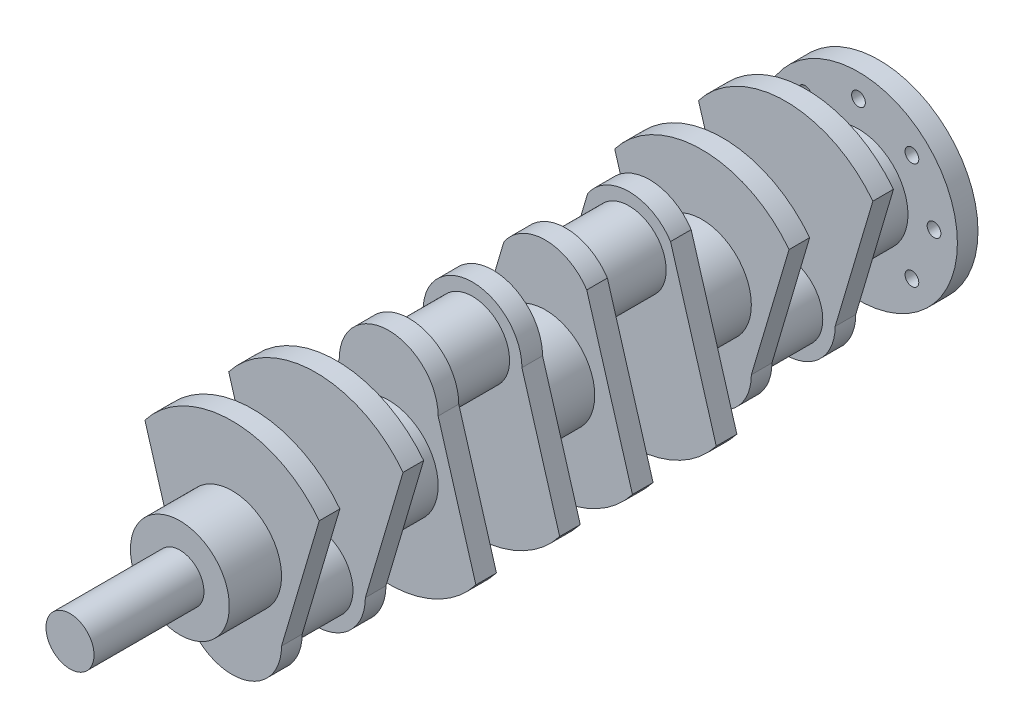
from build123d import *

# Parameters (mm, degrees)
BOSS_EXTRUDE1_DEPTH   = 15
SKETCH2_R             = 27
BOSS_EXTRUDE2_DEPTH   = 46
SKETCH3_R             = 36
BOSS_EXTRUDE3_DEPTH   = 38
SPLIT1_START          = 175
SPLIT1_OUTLINE_R      = 36
SPLIT1_DEPTH          = 53
SPLIT1_START_2        = 114
SPLIT1_2_DEPTH        = 15
SPLIT1_3_OUTLINE_R    = 36
SPLIT1_3_DEPTH        = 15
SPLIT1_START_3        = 129
SPLIT1_4_OUTLINE_R    = 27
SPLIT1_4_DEPTH        = 46
SPLIT1_5_DEPTH        = 114
SPLIT1_6_DEPTH        = 76
SPLIT1_7_DEPTH        = 15
SPLIT1_START_4        = 61
SPLIT1_8_DEPTH        = 15
SPLIT1_9_DEPTH        = 15
SPLIT1_10_DEPTH       = 15
BODY_MOVE_COPY2_ANGLE = 180
SKETCH4_R             = 17.5
BOSS_EXTRUDE4_DEPTH   = 80
SKETCH5_R             = 72
SKETCH5_R_2           = 5
BOSS_EXTRUDE5_DEPTH   = 15


# Read off the part's stored shape, not the designer's step: Split1
with BuildPart() as part:
    # Sketch1 → Boss-Extrude1 (new body)
    with BuildSketch(Plane.XY):
        with BuildLine():
            Line((-63.461769721, 48.709380861), (-36, -44))
            ThreePointArc((-36, -44), (0, -80), (36, -44))
            Line((36, -44), (63.461769721, 48.709380861))
            ThreePointArc((63.461769721, 48.709380861), (0, 80), (-63.461769721, 48.709380861))
        make_face()
    boss_extrude1 = extrude(amount=BOSS_EXTRUDE1_DEPTH)

    # Sketch2 → Boss-Extrude2 (add)
    with BuildSketch(Plane.XY.offset(15)):
        with Locations((0, -44)):
            Circle(SKETCH2_R)
    extrude(amount=BOSS_EXTRUDE2_DEPTH)

    # Sketch3 → Boss-Extrude3 (add)
    with BuildSketch(Plane(origin=(0, 0, 0), x_dir=(-1, 0, 0), z_dir=(0, 0, -1))):
        Circle(SKETCH3_R)
    boss_extrude3 = extrude(amount=BOSS_EXTRUDE3_DEPTH)

    # Mirror1: Boss-Extrude1, Boss-Extrude3 across plane
    add(boss_extrude1.mirror(Plane.XY.offset(38)))
    add(boss_extrude3.mirror(Plane.XY.offset(38)))

    # Mirror7: part across plane


with BuildPart() as part_1:
    add(part.part)
    add(part.part.mirror(Plane.XY.offset(95)))

    # Split1 5 outline → Split1 5 (cut)
    with BuildSketch(Plane.XY.offset(SPLIT1_START_2)):
        with BuildLine():
            Line((36, -44), (63.461769721, 48.709380861))
            ThreePointArc((63.461769721, 48.709380861), (0, 80), (-63.461769721, 48.709380861))
            Line((-63.461769721, 48.709380861), (-36, -44))
            ThreePointArc((-36, -44), (0, -80), (36, -44))
        make_face()
    extrude(amount=SPLIT1_5_DEPTH, mode=Mode.SUBTRACT)

    # Split1 6 outline → Split1 6 (cut)
    with BuildSketch(Plane.XY):
        with BuildLine():
            Line((36, -44), (30.192140446, -63.607005261))
            ThreePointArc((30.192140446, -63.607005261), (34.517510455, -54.22455241), (36, -44))
        make_face()
        with BuildLine():
            ThreePointArc((-36, -44), (-34.517510455, -54.22455241), (-30.192140446, -63.607005261))
            Line((-30.192140446, -63.607005261), (-36, -44))
        make_face()
    extrude(amount=SPLIT1_6_DEPTH, mode=Mode.SUBTRACT)


with BuildPart() as body_2:
    # Split1 outline → Split1 (new body)
    with BuildSketch(Plane.XY.offset(SPLIT1_START)):
        Circle(SPLIT1_OUTLINE_R)
    extrude(amount=SPLIT1_DEPTH)

    # Split1 2 outline → Split1 2 (add)
    with BuildSketch(Plane.XY.offset(SPLIT1_START_2)):
        with BuildLine():
            ThreePointArc((-36, -44), (0, -80), (36, -44))
            Line((36, -44), (63.461769721, 48.709380861))
            ThreePointArc((63.461769721, 48.709380861), (0, 80), (-63.461769721, 48.709380861))
            Line((-63.461769721, 48.709380861), (-36, -44))
        make_face()
    extrude(amount=SPLIT1_2_DEPTH)

    # Split1 3 outline → Split1 3 (add)
    with BuildSketch(Plane.XY.offset(SPLIT1_START)):
        with BuildLine():
            ThreePointArc((-36, -44), (0, -80), (36, -44))
            Line((36, -44), (63.461769721, 48.709380861))
            ThreePointArc((63.461769721, 48.709380861), (0, 80), (-63.461769721, 48.709380861))
            Line((-63.461769721, 48.709380861), (-36, -44))
        make_face()
        Circle(SPLIT1_3_OUTLINE_R, mode=Mode.SUBTRACT)
    extrude(amount=SPLIT1_3_DEPTH)

    # Split1 4 outline → Split1 4 (add)
    with BuildSketch(Plane.XY.offset(SPLIT1_START_3)):
        with Locations((0, -44)):
            Circle(SPLIT1_4_OUTLINE_R)
    extrude(amount=SPLIT1_4_DEPTH)


with BuildPart() as body_3:
    # Split1 7 outline → Split1 7 (new body)
    with BuildSketch(Plane.XY):
        with BuildLine():
            Line((36, -44), (30.192140446, -63.607005261))
            ThreePointArc((30.192140446, -63.607005261), (34.517510455, -54.224552409), (36, -44))
        make_face()
    extrude(amount=SPLIT1_7_DEPTH)


with BuildPart() as body_4:
    # Split1 8 outline → Split1 8 (new body)
    with BuildSketch(Plane.XY.offset(SPLIT1_START_4)):
        with BuildLine():
            Line((-30.192140446, -63.607005261), (-36, -44))
            ThreePointArc((-36, -44), (-34.517510455, -54.224552409), (-30.192140446, -63.607005261))
        make_face()
    extrude(amount=SPLIT1_8_DEPTH)


with BuildPart() as body_5:
    # Split1 9 outline → Split1 9 (new body)
    with BuildSketch(Plane.XY.offset(SPLIT1_START_4)):
        with BuildLine():
            Line((36, -44), (30.192140446, -63.607005261))
            ThreePointArc((30.192140446, -63.607005261), (34.517510455, -54.224552409), (36, -44))
        make_face()
    extrude(amount=SPLIT1_9_DEPTH)


with BuildPart() as body_6:
    # Split1 10 outline → Split1 10 (new body)
    with BuildSketch(Plane.XY):
        with BuildLine():
            Line((-30.192140446, -63.607005261), (-36, -44))
            ThreePointArc((-36, -44), (-34.517510455, -54.224552409), (-30.192140446, -63.607005261))
        make_face()
    extrude(amount=SPLIT1_10_DEPTH)


with BuildPart() as body_6_1:
    # Body-Move/Copy2: moved
    add(body_6.part.rotate(Axis((0, 0, 0), (0, 0, 1)), BODY_MOVE_COPY2_ANGLE))


with BuildPart() as body_5_1:
    # Body-Move/Copy2: moved
    add(body_5.part.rotate(Axis((0, 0, 0), (0, 0, 1)), BODY_MOVE_COPY2_ANGLE))


with BuildPart() as body_4_1:
    # Body-Move/Copy2: moved
    add(body_4.part.rotate(Axis((0, 0, 0), (0, 0, 1)), BODY_MOVE_COPY2_ANGLE))


with BuildPart() as body_3_1:
    # Body-Move/Copy2: moved
    add(body_3.part.rotate(Axis((0, 0, 0), (0, 0, 1)), BODY_MOVE_COPY2_ANGLE))


with BuildPart() as part_2:
    # Body-Move/Copy2: moved
    add(part_1.part.rotate(Axis((0, 0, 0), (0, 0, 1)), BODY_MOVE_COPY2_ANGLE))


with BuildPart() as body_7:
    # Mirror8: mirrored copy
    add(part_2.part.mirror(Plane(origin=(0, 0, -19), x_dir=(1, 0, 0), z_dir=(0, 0, -1))))


with BuildPart() as body_8:
    # Mirror8 2: mirrored copy
    add(body_2.part.mirror(Plane(origin=(0, 0, -19), x_dir=(1, 0, 0), z_dir=(0, 0, -1))))

    # Sketch5 → Boss-Extrude5 (add)
    with BuildSketch(Plane(origin=(0, 0, -266), x_dir=(-1, 0, 0), z_dir=(0, 0, -1))):
        Circle(SKETCH5_R)
        with Locations((0, 55)):
            Circle(SKETCH5_R_2, mode=Mode.SUBTRACT)
        with Locations((38.890872965, 38.890872965)):
            Circle(SKETCH5_R_2, mode=Mode.SUBTRACT)
        with Locations((55, 0)):
            Circle(SKETCH5_R_2, mode=Mode.SUBTRACT)
        with Locations((38.890872965, -38.890872965)):
            Circle(SKETCH5_R_2, mode=Mode.SUBTRACT)
        with Locations((0, -55)):
            Circle(SKETCH5_R_2, mode=Mode.SUBTRACT)
        with Locations((-38.890872965, -38.890872965)):
            Circle(SKETCH5_R_2, mode=Mode.SUBTRACT)
        with Locations((-55, 0)):
            Circle(SKETCH5_R_2, mode=Mode.SUBTRACT)
        with Locations((-38.890872965, 38.890872965)):
            Circle(SKETCH5_R_2, mode=Mode.SUBTRACT)
    extrude(amount=BOSS_EXTRUDE5_DEPTH)


with BuildPart() as body_2_1:
    add(body_2.part)

    # Sketch4 → Boss-Extrude4 (add)
    with BuildSketch(Plane.XY.offset(228)):
        Circle(SKETCH4_R)
    extrude(amount=BOSS_EXTRUDE4_DEPTH)


with BuildPart() as body_7_1:
    add(body_7.part)

    # Combine2: union part, body 2, body 6, body 4, body 3, body 5
    add(part_2.part)
    add(body_2_1.part)
    add(body_6_1.part)
    add(body_4_1.part)
    add(body_3_1.part)
    add(body_5_1.part)


solid = Compound([body_8.part, body_7_1.part])
